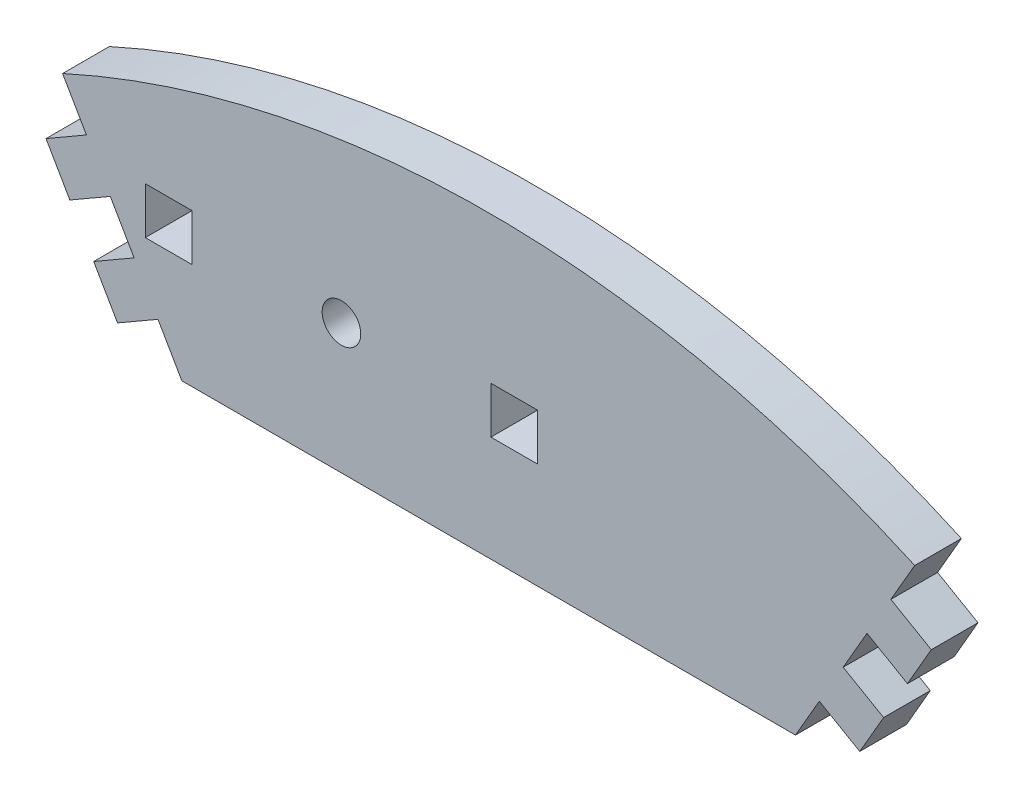
from build123d import *

# Parameters (mm, degrees)
BOSS_EXTRUDE1_DEPTH = 5
SKETCH2_R           = 2.0675
SKETCH2_W           = 5
SKETCH2_H           = 5
CUT_EXTRUDE1_DEPTH  = 120.879162924


with BuildPart() as part:
    # Sketch1 → Boss-Extrude1 (new body)
    with BuildSketch(Plane.XY):
        with BuildLine():
            Line((-32.85, 77.986683936), (32.85, 77.986683936))
            Line((32.85, 77.986683936), (35.403, 82.408609648))
            Line((35.403, 82.408609648), (39.733127019, 79.908609648))
            Line((39.733127019, 79.908609648), (42.286127019, 84.330535359))
            Line((42.286127019, 84.330535359), (37.956, 86.830535359))
            Line((37.956, 86.830535359), (40.509, 91.252461071))
            Line((40.509, 91.252461071), (44.839127019, 88.752461071))
            Line((44.839127019, 88.752461071), (47.392127019, 93.174386783))
            Line((47.392127019, 93.174386783), (43.062, 95.674386783))
            Line((43.062, 95.674386783), (45.615, 100.096312495))
            ThreePointArc((45.615, 100.096312495), (0, 110), (-45.615, 100.096312495))
            Line((-45.615, 100.096312495), (-43.062, 95.674386783))
            Line((-43.062, 95.674386783), (-47.392127019, 93.174386783))
            Line((-47.392127019, 93.174386783), (-44.839127019, 88.752461071))
            Line((-44.839127019, 88.752461071), (-40.509, 91.252461071))
            Line((-40.509, 91.252461071), (-37.956, 86.830535359))
            Line((-37.956, 86.830535359), (-42.286127019, 84.330535359))
            Line((-42.286127019, 84.330535359), (-39.733127019, 79.908609648))
            Line((-39.733127019, 79.908609648), (-35.403, 82.408609648))
            Line((-35.403, 82.408609648), (-32.85, 77.986683936))
        make_face()
    extrude(amount=BOSS_EXTRUDE1_DEPTH)

    # Sketch2 → Cut-Extrude1 (cut, through all)
    with BuildSketch(Plane.XY.offset(5)):
        with Locations((-15.76, 91.897414387)):
            Circle(SKETCH2_R)
        with Locations((2.74, 91.807821113)):
            Rectangle(SKETCH2_W, SKETCH2_H)
        with Locations((-34.26, 91.807821113)):
            Rectangle(SKETCH2_W, SKETCH2_H)
    extrude(amount=-CUT_EXTRUDE1_DEPTH, mode=Mode.SUBTRACT)


solid = part.part
